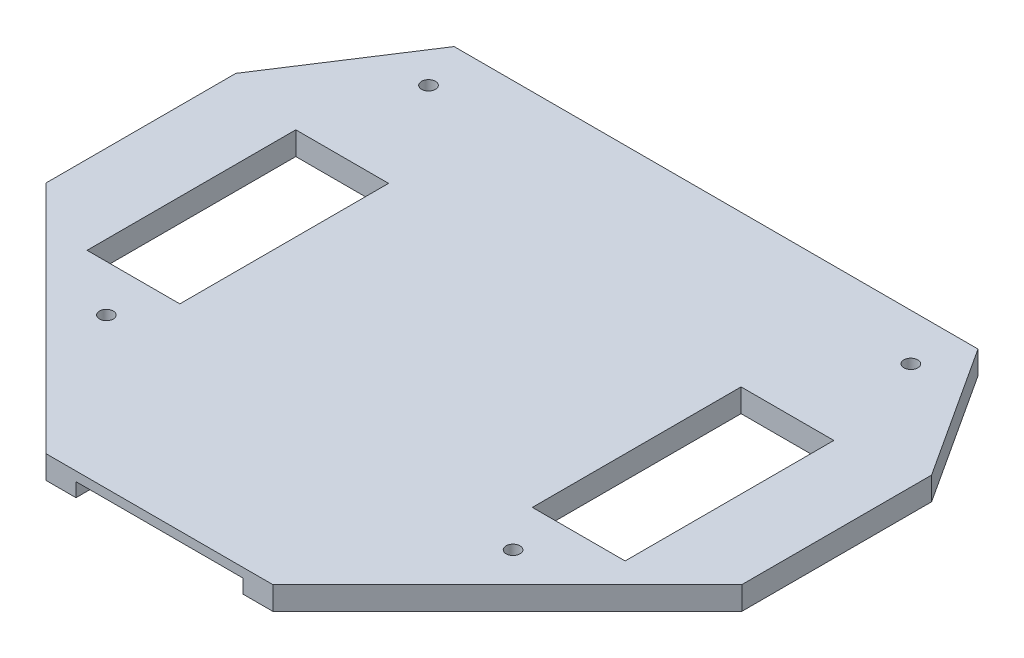
from build123d import *

# Parameters (mm, degrees)
BOSS_EXTRUDE1_DEPTH          = 5
F_3_0_3_DIAMETER_HOLE1_D     = 3
F_3_0_3_DIAMETER_HOLE1_DEPTH = 6
F_3_0_3_DIAMETER_HOLE1_TIP   = 0.901290929
SKETCH6_W                    = 36
SKETCH6_H                    = 124
CUT_EXTRUDE1_DEPTH           = 3
SKETCH9_W                    = 20
SKETCH9_H                    = 45
CUT_EXTRUDE3_DEPTH           = 169.089262001


with BuildPart() as part:
    # Sketch3 → Boss-Extrude1 (new body)
    with BuildSketch(Plane(origin=(0, -40, 0), x_dir=(-1, 0, 0), z_dir=(0, -1, 0))):
        Polygon((27.539235226, -110), (76.462005641, -110), (127, -59.462005641), (127, -18.529510204), (108.472719443, 10), (-4.471478576, 10), (-23, -18.531420972), (-23, -59.460764774), align=None)
    extrude(amount=BOSS_EXTRUDE1_DEPTH)

    # Ø3.0 (3) Diameter Hole1
    with Locations(Plane(origin=(0, -45, 0), x_dir=(-1, 0, 0), z_dir=(0, -1, 0))):
        with Locations((8.156954779, -77.608240604), (95.838195646, -77.608240604), (103.995150425, 0), (0, 0)):
            Hole(F_3_0_3_DIAMETER_HOLE1_D / 2, depth=F_3_0_3_DIAMETER_HOLE1_DEPTH)
            with Locations((0, 0, -(F_3_0_3_DIAMETER_HOLE1_DEPTH + F_3_0_3_DIAMETER_HOLE1_TIP / 2))):  # 118° drill point
                Cone(0, F_3_0_3_DIAMETER_HOLE1_D / 2, F_3_0_3_DIAMETER_HOLE1_TIP, mode=Mode.SUBTRACT)

    # Sketch6 → Cut-Extrude1 (cut)
    with BuildSketch(Plane(origin=(0, -45, 0), x_dir=(-1, 0, 0), z_dir=(0, -1, 0))):
        with Locations((52, -55)):
            Rectangle(SKETCH6_W, SKETCH6_H)
    extrude(amount=-CUT_EXTRUDE1_DEPTH, mode=Mode.SUBTRACT)

    # Sketch9 → Cut-Extrude3 (cut, through all)
    with BuildSketch(Plane(origin=(0, -45, 0), x_dir=(-1, 0, 0), z_dir=(0, -1, 0))):
        with Locations((4, -45.108240604)):
            Rectangle(SKETCH9_W, SKETCH9_H)
    cut_extrude3 = extrude(amount=-CUT_EXTRUDE3_DEPTH, mode=Mode.SUBTRACT)

    # Mirror1: Cut-Extrude3 across plane
    add(cut_extrude3.mirror(Plane.ZY.offset(52)), mode=Mode.SUBTRACT)


solid = part.part
